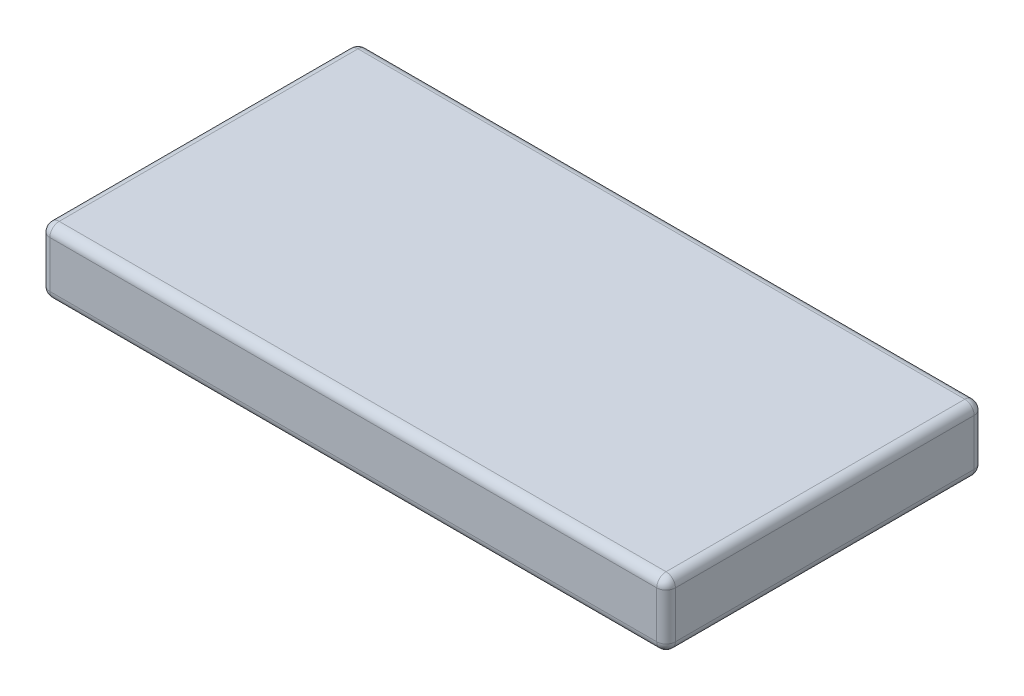
from build123d import *

# Parameters (mm, degrees)
SKETCH1_W           = 67
SKETCH1_H           = 34
BOSS_EXTRUDE1_DEPTH = 7
FILLET1_R           = 1


with BuildPart() as part:
    # Sketch1 → Boss-Extrude1 (new body)
    with BuildSketch(Plane(origin=(0, 0, 0), x_dir=(1, 0, 0), z_dir=(0, 1, 0))):
        Rectangle(SKETCH1_W, SKETCH1_H)
    extrude(amount=BOSS_EXTRUDE1_DEPTH)

    # Fillet1
    fillet1_edges = [part.edges().sort_by_distance(p)[0] for p in [
        (-33.5, 3.5, -17),
        (33.5, 3.5, -17),
        (-33.5, 7, 0),
        (0, 7, -17),
        (33.5, 7, 0),
        (-33.5, 3.5, 17),
        (0, 7, 17),
        (33.5, 3.5, 17),
        (0, 0, -17),
        (-33.5, 0, 0),
        (0, 0, 17),
        (33.5, 0, 0),
    ]]
    fillet(fillet1_edges, radius=FILLET1_R)


solid = part.part
